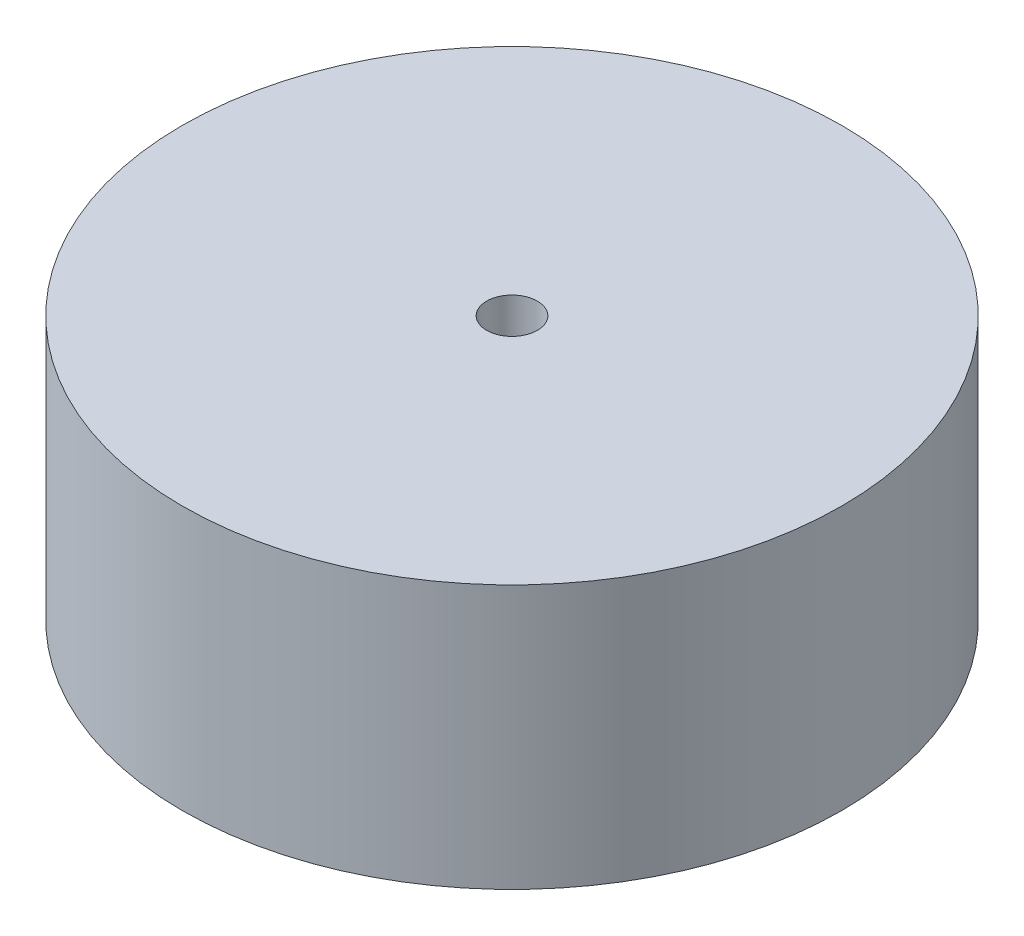
from build123d import *

# Parameters (mm, degrees)
SKETCH1_R           = 32.5
BOSS_EXTRUDE1_DEPTH = 26
SKETCH3_R           = 2.5
CUT_EXTRUDE1_DEPTH  = 77.848283051


with BuildPart() as part:
    # Sketch1 → Boss-Extrude1 (new body)
    with BuildSketch(Plane(origin=(0, 0, 0), x_dir=(1, 0, 0), z_dir=(0, 1, 0))):
        with Locations((-29.725277397, 4.346620751)):
            Circle(SKETCH1_R)
    extrude(amount=BOSS_EXTRUDE1_DEPTH)

    # Sketch3 → Cut-Extrude1 (cut, through all)
    with BuildSketch(Plane.XZ):
        with Locations((-29.725277397, -4.346620751)):
            Circle(SKETCH3_R)
    extrude(amount=-CUT_EXTRUDE1_DEPTH, mode=Mode.SUBTRACT)


solid = part.part
